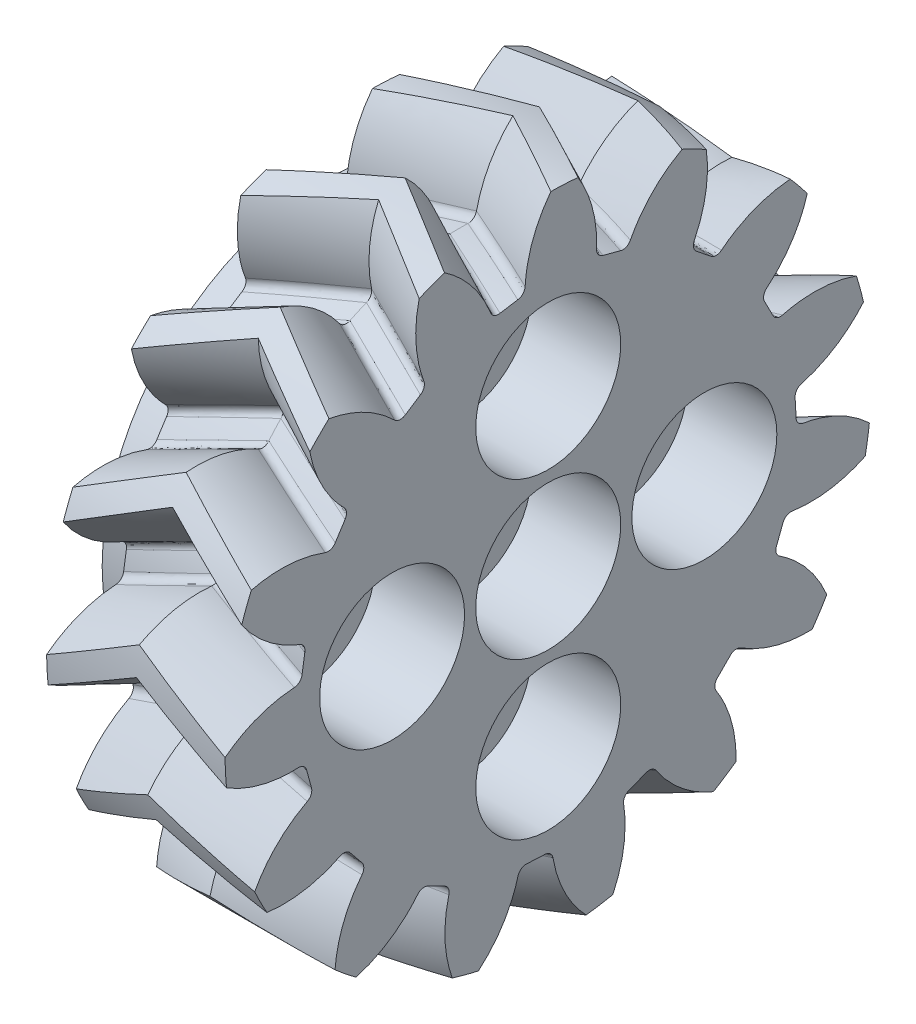
from build123d import *

# Parameters (mm, degrees)
BASPROSKE_W                = 4
BASPROSKE_H                = 14.490381057
TOOTHCUTRH_PITCH           = 157.69586369
TOOTHCUTRH_HEIGHT          = 4
TOOTHCUTRH_RADIUS          = 14.490381057
TOOTHCUTRH_START_ANGLE     = -90
TEETHCUTSRH_COUNT          = 15
TEETHCUTSRH_ANGLE          = 336
BORSKE_R                   = 0.4
BORE_DEPTH                 = 62.5000025
ESQUISSE1_R                = 1.6
ENL_V_MAT_EXTRU_1_DEPTH    = 22.998688485
ESQUISSE2_R                = 10
ESQUISSE2_R_2              = 1.6
BOSS_EXTRU_1_DEPTH         = 2
PER_AGEAVANC_1_OUTLINE_R   = 3.25
PER_AGEAVANC_1_OUTLINE_R_2 = 1.6
PER_AGEAVANC_1_DEPTH       = 4


# Read off the part's stored shape, not the designer's step: PerçageAvancé1
with BuildPart() as part:
    # BasProSke → Base-Revolve (revolve)
    with BuildSketch(Plane(origin=(0, 0, 0), x_dir=(1, 0, 0), z_dir=(0, 1, 0)), mode=Mode.PRIVATE) as base_revolve_sk:
        with Locations((2, 7.245190529)):
            Rectangle(BASPROSKE_W, BASPROSKE_H)
    revolve(base_revolve_sk.sketch.rotate(Axis((-10, 0, 0), (1, 0, 0)), 180), axis=Axis((-10, 0, 0), (1, 0, 0)))

    # ToothCutRH: sweep along a helix
    with BuildLine() as toothcutrh_path:
        add(Helix(TOOTHCUTRH_PITCH, TOOTHCUTRH_HEIGHT, TOOTHCUTRH_RADIUS, center=(0, 0, 0), direction=(1, 0, 0), mode=Mode.PRIVATE).rotate(Axis((0, 0, 0), (1, 0, 0)), TOOTHCUTRH_START_ANGLE))
    # TooCutSkeRH → ToothCutRH (sweep, cut)
    with BuildSketch(Plane(origin=(0, 0, 0), x_dir=(0, 0, -1), z_dir=(1, 0, 0))):
        with BuildLine():
            ThreePointArc((0.402978198, 11.108073848), (0, 11.115381057), (-0.402978198, 11.108073848))
            ThreePointArc((-0.402978198, 11.108073848), (-0.646934934, 11.186629248), (-0.783878431, 11.40326793))
            ThreePointArc((-0.783878431, 11.40326793), (-1.526929362, 13.20899917), (-2.842529503, 14.651908129))
            ThreePointArc((-2.842529503, 14.651908129), (0, 14.925092488), (2.842529503, 14.651908129))
            ThreePointArc((2.842529503, 14.651908129), (1.526929362, 13.20899917), (0.783878431, 11.40326793))
            ThreePointArc((0.783878431, 11.40326793), (0.646934934, 11.186629248), (0.402978198, 11.108073848))
        make_face()
    toothcutrh = sweep(path=toothcutrh_path.line, is_frenet=True, mode=Mode.SUBTRACT)

    # TeethCutsRH: ToothCutRH ×15 about axis
    teethcutsrh_axis = Axis((-10, 0, 0), (1, 0, 0))
    for i in range(1, TEETHCUTSRH_COUNT):
        add(toothcutrh.rotate(teethcutsrh_axis, i * TEETHCUTSRH_ANGLE / (TEETHCUTSRH_COUNT - 1)), mode=Mode.SUBTRACT)

    # BorSke → Bore (cut, symmetric)
    with BuildSketch(Plane(origin=(0, 0, 0), x_dir=(0, 0, -1), z_dir=(1, 0, 0))):
        with Locations(Location((0, 0, 0), (0, 0, 180))):
            Circle(BORSKE_R)
    extrude(amount=BORE_DEPTH, both=True, mode=Mode.SUBTRACT)

    # Symétrie1: part across plane


with BuildPart() as part_1:
    add(part.part)
    add(part.part.mirror(Plane(origin=(0, 0, 0), x_dir=(0, 0, 1), z_dir=(1, 0, 0))))

    # Esquisse1 → Enlèv. mat.-Extru.1 (cut, through all)
    with BuildSketch(Plane(origin=(4, 0, 0), x_dir=(0, 0, -1), z_dir=(1, 0, 0))):
        with Locations((0, 7)):
            Circle(ESQUISSE1_R)
        Circle(ESQUISSE1_R)
        with Locations((7, 0)):
            Circle(ESQUISSE1_R)
        with Locations((0, -7)):
            Circle(ESQUISSE1_R)
        with Locations((-7, 0)):
            Circle(ESQUISSE1_R)
    extrude(amount=-ENL_V_MAT_EXTRU_1_DEPTH, mode=Mode.SUBTRACT)

    # Esquisse2 → Boss.-Extru.1 (add)
    with BuildSketch(Plane.ZY.offset(4)):
        with Locations(Location((0, 0, 0), (0, 0, 180))):
            Circle(ESQUISSE2_R)
        with Locations(Location((0, 7, 0), (0, 0, 180))):
            Circle(ESQUISSE2_R_2, mode=Mode.SUBTRACT)
        with Locations(Location((7, 0, 0), (0, 0, 180))):
            Circle(ESQUISSE2_R_2, mode=Mode.SUBTRACT)
        with Locations(Location((0, -7, 0), (0, 0, 180))):
            Circle(ESQUISSE2_R_2, mode=Mode.SUBTRACT)
        with Locations(Location((0, 0, 0), (0, 0, 180))):
            Circle(ESQUISSE2_R_2, mode=Mode.SUBTRACT)
        with Locations(Location((-7, 0, 0), (0, 0, 180))):
            Circle(ESQUISSE2_R_2, mode=Mode.SUBTRACT)
    extrude(amount=BOSS_EXTRU_1_DEPTH)

    # PerçageAvancé1 outline → PerçageAvancé1 (cut)
    # profile 1 of 5: a face of its own
    with BuildSketch(Plane.YZ):
        Circle(PER_AGEAVANC_1_OUTLINE_R)
        Circle(PER_AGEAVANC_1_OUTLINE_R_2, mode=Mode.SUBTRACT)
    # profile 2 of 5: a face of its own
    with BuildSketch(Plane.YZ):
        with Locations((0, -7)):
            Circle(PER_AGEAVANC_1_OUTLINE_R)
        with Locations((0, -7)):
            Circle(PER_AGEAVANC_1_OUTLINE_R_2, mode=Mode.SUBTRACT)
    # profile 3 of 5: a face of its own
    with BuildSketch(Plane.YZ):
        with Locations((-7, 0)):
            Circle(PER_AGEAVANC_1_OUTLINE_R)
        with Locations((-7, 0)):
            Circle(PER_AGEAVANC_1_OUTLINE_R_2, mode=Mode.SUBTRACT)
    # profile 4 of 5: a face of its own
    with BuildSketch(Plane.YZ):
        with Locations((0, 7)):
            Circle(PER_AGEAVANC_1_OUTLINE_R)
        with Locations((0, 7)):
            Circle(PER_AGEAVANC_1_OUTLINE_R_2, mode=Mode.SUBTRACT)
    # profile 5 of 5: a face of its own
    with BuildSketch(Plane.YZ):
        with Locations((7, 0)):
            Circle(PER_AGEAVANC_1_OUTLINE_R)
        with Locations((7, 0)):
            Circle(PER_AGEAVANC_1_OUTLINE_R_2, mode=Mode.SUBTRACT)
    extrude(amount=PER_AGEAVANC_1_DEPTH, mode=Mode.SUBTRACT)


solid = part_1.part
